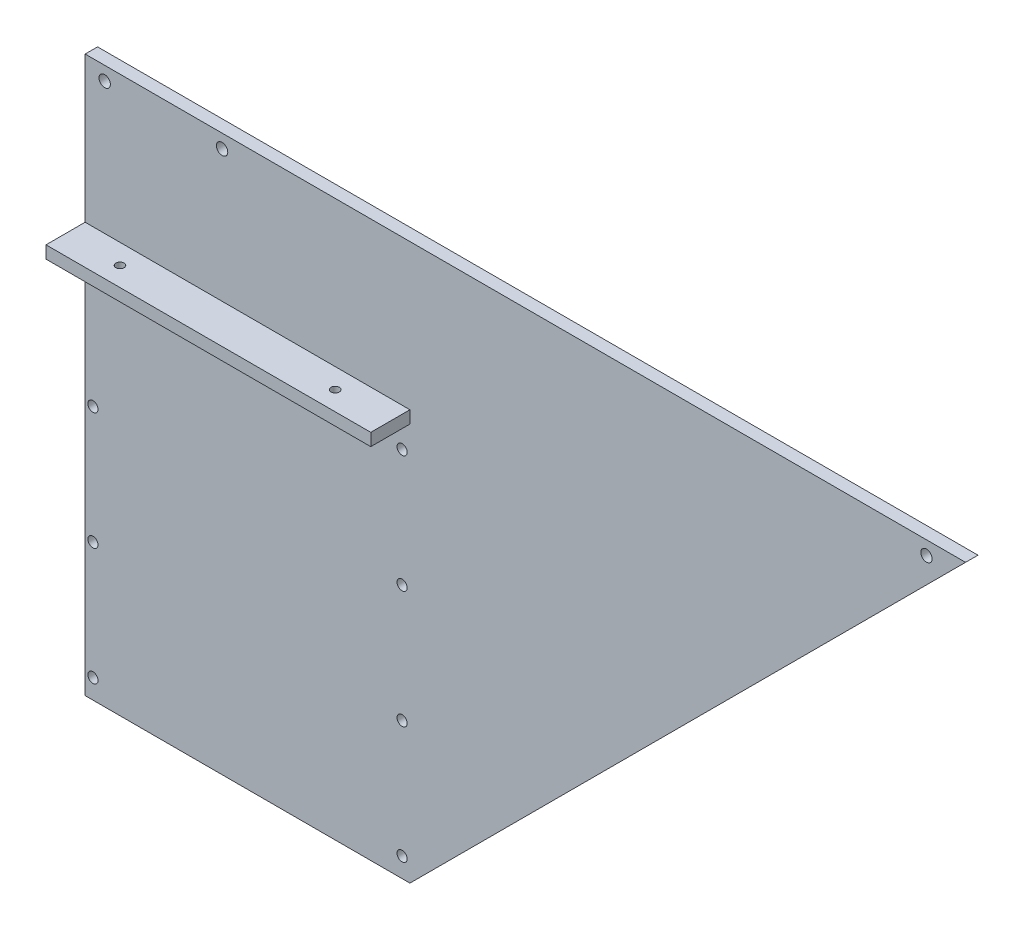
from build123d import *

# Parameters (mm, degrees)
MAIN_SHAPE_DEPTH       = 1.5875
SKETCH2_W              = 83
SKETCH2_H              = 3.175
Y_LIP_DEPTH            = 10
LIP_HOLES_D            = 2.1
BODY_FASTENERS_D       = 2.6
M2_5_CLEARANCE_HOLE1_D = 2.9


with BuildPart() as part:
    # Sketch1 → Main Shape (new, symmetric)
    with BuildSketch(Plane.XY):
        Polygon((0, -71), (142, 71), (-83, 71), (-83, -71), align=None)
    extrude(amount=MAIN_SHAPE_DEPTH, both=True)

    # Sketch2 → Y lip (add)
    with BuildSketch(Plane(origin=(0, 0, 1.5875), x_dir=(-1, 0, 0), z_dir=(0, 0, -1))):
        with Locations((41.5, 32.1875)):
            Rectangle(SKETCH2_W, SKETCH2_H)
    extrude(amount=-Y_LIP_DEPTH)

    # Lip holes (through all)
    with Locations(Plane(origin=(0, 33.775, 0), x_dir=(1, 0, 0), z_dir=(0, 1, 0))):
        with Locations((-69, -6.6875), (-14, -6.6875)):
            Hole(LIP_HOLES_D / 2)

    # Body fasteners (through all)
    with Locations(Plane(origin=(0, 0, -1.5875), x_dir=(-1, 0, 0), z_dir=(0, 0, -1))):
        with Locations((81, -66), (81, -36), (81, -6), (81, 24), (2, 24), (2, -6), (2, -36), (2, -66)):
            Hole(BODY_FASTENERS_D / 2)

    # M2.5 Clearance Hole1 (through all)
    with Locations(Plane.XY.offset(1.5875)):
        with Locations((132, 67.5), (-48, 67.5), (-78, 67.5)):
            Hole(M2_5_CLEARANCE_HOLE1_D / 2)


solid = part.part
